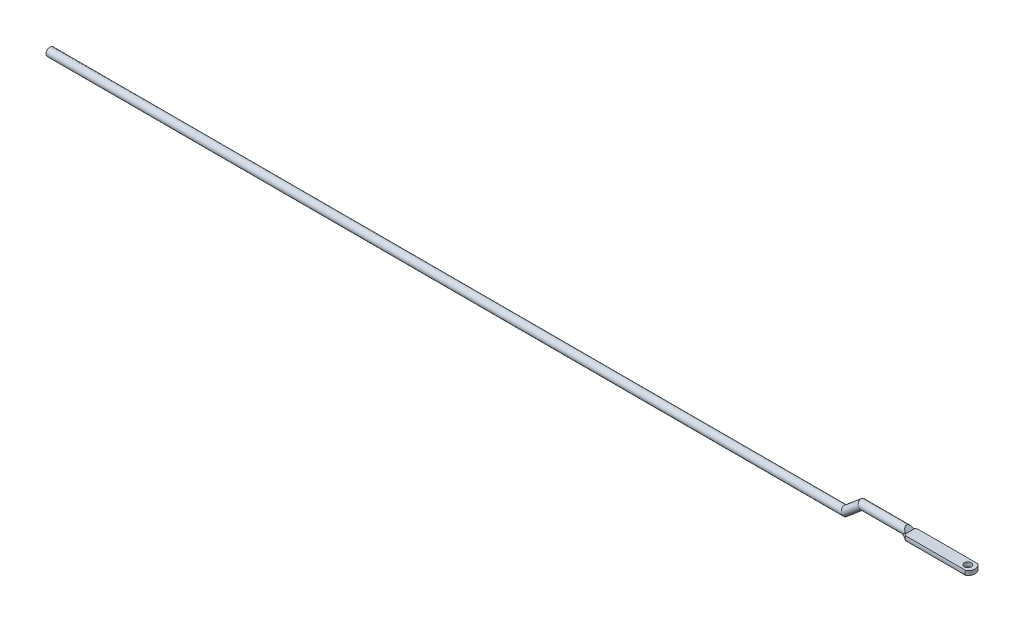
from build123d import *

# Parameters (mm, degrees)
SKETCH2_R               = 4.75
BOSS_EXTRUDE1_DEPTH     = 77
SKETCH4_R               = 4.125
CUT_EXTRUDE1_DEPTH      = 77
CUT_EXTRUDE2_DEPTH      = 77
CUT_EXTRUDE3_DEPTH      = 77
CUT_EXTRUDE3_DEPTH_BACK = 77
BOSS_EXTRUDE2_START     = 4
BOSS_EXTRUDE2_DEPTH     = 4
CHAMFER1_SIZE           = 6
CHAMFER1_SIZE_2         = 3.5


with BuildPart() as part:
    # Sweep1: sweep along a path in Sketch1
    with BuildLine(Plane.XY) as sweep1_path:
        Line((0, 0), (940, 0))
        Line((940, 0), (960, 16.781992624))
        Line((960, 16.781992624), (1016, 16.781992624))
    # Sketch2 → Sweep1 (sweep)
    with BuildSketch(Plane(origin=(0, 0, 0), x_dir=(0, 0, -1), z_dir=(1, 0, 0))):
        Circle(SKETCH2_R)
    sweep(path=sweep1_path.line, transition=Transition.RIGHT)

    # Sketch3 → Boss-Extrude1 (add)
    with BuildSketch(Plane(origin=(1016, 0, 0), x_dir=(0, 0, -1), z_dir=(1, 0, 0))):
        with BuildLine():
            Line((-7.071067812, 12.031992624), (7.071067812, 12.031992624))
            ThreePointArc((7.071067812, 12.031992624), (7.5, 14.531992624), (7.071067812, 17.031992624))
            Line((7.071067812, 17.031992624), (-7.071067812, 17.031992624))
            ThreePointArc((-7.071067812, 17.031992624), (-7.5, 14.531992624), (-7.071067812, 12.031992624))
        make_face()
    extrude(amount=BOSS_EXTRUDE1_DEPTH)

    # Sketch4 → Cut-Extrude1 (cut)
    with BuildSketch(Plane(origin=(0, 17.031992624, 0), x_dir=(1, 0, 0), z_dir=(0, 1, 0))):
        with Locations(Location((1084.475, 0, 0), (0, 0, 270))):
            Circle(SKETCH4_R)
    extrude(amount=-CUT_EXTRUDE1_DEPTH, mode=Mode.SUBTRACT)

    # Sketch5 → Cut-Extrude2 (cut)
    with BuildSketch(Plane(origin=(0, 17.031992624, 0), x_dir=(1, 0, 0), z_dir=(0, 1, 0))):
        with BuildLine():
            Line((1093, 7.5), (1088.527853933, 7.5))
            ThreePointArc((1088.527853933, 7.5), (1093, 0), (1088.527853933, -7.5))
            Line((1088.527853933, -7.5), (1093, -7.5))
            Line((1093, -7.5), (1095.488265068, 1.431081092))
            Line((1095.488265068, 1.431081092), (1093, 7.5))
        make_face()
    extrude(amount=-CUT_EXTRUDE2_DEPTH, mode=Mode.SUBTRACT)

    # Sketch6 → Cut-Extrude3 (cut, two sides: drawn at the far end of the back side and taken through both)
    with BuildSketch(Plane.XY.offset(-CUT_EXTRUDE3_DEPTH_BACK)):
        Polygon((1016, 17.031992624), (1012, 21.531992624), (1018.885341188, 26.165219669), (1022.40477818, 20.935058436), align=None)
    extrude(amount=CUT_EXTRUDE3_DEPTH + CUT_EXTRUDE3_DEPTH_BACK, mode=Mode.SUBTRACT)

    # Sketch7 → Boss-Extrude2 (add)
    with BuildSketch(Plane.ZY.offset(-1016).offset(BOSS_EXTRUDE2_START)):
        with BuildLine():
            Line((7.071067812, 17.031992624), (4.74341649, 17.031992624))
            Line((4.74341649, 17.031992624), (-4.74341649, 17.031992624))
            Line((-4.74341649, 17.031992624), (-7.071067812, 17.031992624))
            ThreePointArc((-7.071067812, 17.031992624), (-7.5, 14.531992624), (-7.071067812, 12.031992624))
            Line((-7.071067812, 12.031992624), (0, 12.031992624))
            Line((0, 12.031992624), (7.071067812, 12.031992624))
            ThreePointArc((7.071067812, 12.031992624), (7.5, 14.531992624), (7.071067812, 17.031992624))
        make_face()
    extrude(amount=-BOSS_EXTRUDE2_DEPTH)

    # Chamfer1
    # the kernel refuses this chamfer: 6, 3.5 mm, written as the material it takes off along each edge
    with BuildSketch(Plane(origin=(1012, 14.531992624, 0), x_dir=(0, 0.6684369034983231, 0.7437688525621206), z_dir=(0, -0.7437688525621206, 0.6684369034983231))) as chamfer1_piece_1_section:
        Polygon((7.5, -CHAMFER1_SIZE), (7.5 - CHAMFER1_SIZE_2, 0), (7.5, 0), align=None)
    chamfer1_piece_1 = revolve(axis=Axis((1012, 14.531992624, 0), (-1, 0, 0)), revolution_arc=276.106922799, mode=Mode.PRIVATE)
    chamfer1_piece_1 = chamfer1_piece_1 - Plane(origin=(1014.966337757, 16.781992624, 0), x_dir=(0, 0, -1), z_dir=(1, 0, 0)) * Cylinder(4.75, 30, mode=Mode.PRIVATE)
    add(chamfer1_piece_1, mode=Mode.SUBTRACT)
    with BuildSketch(Plane(origin=(1012, 14.531992624, 0), x_dir=(0, -0.668436903498336, -0.743768852562109), z_dir=(0, 0.743768852562109, -0.668436903498336))) as chamfer1_piece_2_section:
        Polygon((7.5 - CHAMFER1_SIZE_2, 0), (7.5, -CHAMFER1_SIZE), (7.5, 0), align=None)
    chamfer1_piece_2 = revolve(axis=Axis((1012, 14.531992624, 0), (-1, 0, 0)), revolution_arc=276.106922799, mode=Mode.PRIVATE)
    chamfer1_piece_2 = chamfer1_piece_2 - Plane(origin=(1014.966337768, 16.781992624, 0), x_dir=(0, 0, -1), z_dir=(1, 0, 0)) * Cylinder(4.75, 31, mode=Mode.PRIVATE)
    add(chamfer1_piece_2, mode=Mode.SUBTRACT)


solid = part.part
